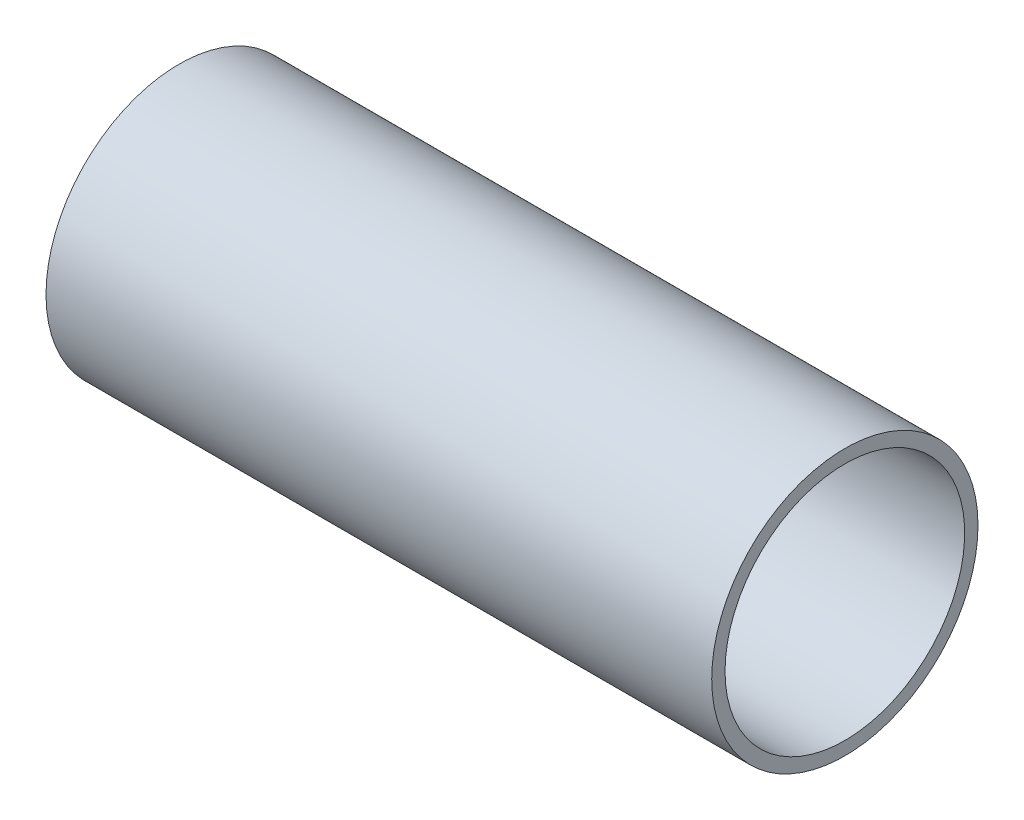
from build123d import *

# Parameters (mm, degrees)
SKETCH2_R           = 254
SKETCH2_R_2         = 228.6
BOSS_EXTRUDE1_DEPTH = 635


with BuildPart() as part:
    # Sketch2 → Boss-Extrude1 (new, symmetric)
    with BuildSketch(Plane(origin=(0, 0, 0), x_dir=(0, 0, -1), z_dir=(1, 0, 0))):
        Circle(SKETCH2_R)
        Circle(SKETCH2_R_2, mode=Mode.SUBTRACT)
    extrude(amount=BOSS_EXTRUDE1_DEPTH, both=True)


solid = part.part
